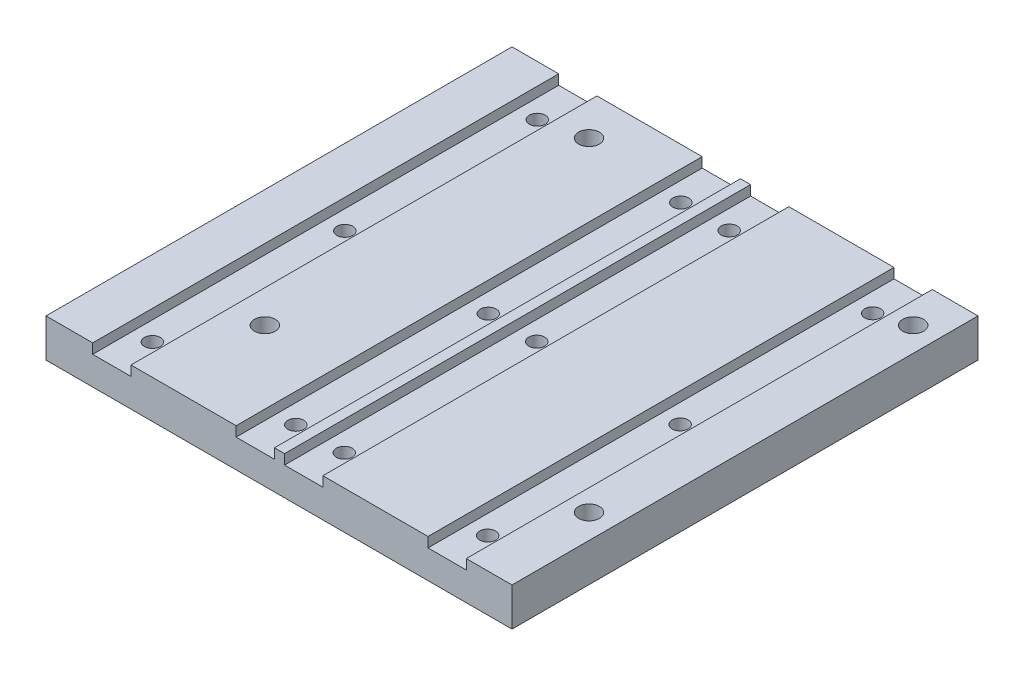
from build123d import *

# Parameters (mm, degrees)
SKETCH1_W                                       = 146.05
SKETCH1_H                                       = 146.05
BOSS_EXTRUDE1_DEPTH                             = 12
F_1_4_CLEARANCE_HOLE1_D                         = 6.5278
SKETCH4_W                                       = 12
SKETCH4_H                                       = 3.11
CUT_EXTRUDE1_DEPTH                              = 164.729206695
CBORE_FOR_10_SOCKET_HEAD_CAP_SCREW1_D           = 4.9784
CBORE_FOR_10_SOCKET_HEAD_CAP_SCREW1_CBORE_D     = 9.525
CBORE_FOR_10_SOCKET_HEAD_CAP_SCREW1_CBORE_DEPTH = 5.08
LPATTERN1_COUNT                                 = 2
LPATTERN1_PITCH                                 = 44.958
LPATTERN1_COUNT_DIR2                            = 2
LPATTERN1_PITCH_DIR2                            = 60.132999876


with BuildPart() as part:
    # Sketch1 → Boss-Extrude1 (new body)
    with BuildSketch(Plane(origin=(0, 0, 0), x_dir=(1, 0, 0), z_dir=(0, 1, 0))):
        Rectangle(SKETCH1_W, SKETCH1_H)
    extrude(amount=-BOSS_EXTRUDE1_DEPTH)

    # 1/4 Clearance Hole1 (through all)
    with Locations(Plane(origin=(0, 0, 0), x_dir=(1, 0, 0), z_dir=(0, 1, 0))):
        with Locations((-36.195, 60.325), (-36.195, -41.275), (65.405, -41.275), (65.405, 60.325)):
            Hole(F_1_4_CLEARANCE_HOLE1_D / 2)

    # Sketch4 → Cut-Extrude1 (cut, through all)
    with BuildSketch(Plane.XY.offset(73.025)):
        with Locations((52.705, -1.555)):
            Rectangle(SKETCH4_W, SKETCH4_H)
    cut_extrude1 = extrude(amount=-CUT_EXTRUDE1_DEPTH, mode=Mode.SUBTRACT)

    # CBORE for #10 Socket Head Cap Screw1 (through all)
    with Locations(Plane(origin=(0, -12, 0), x_dir=(-1, 0, 0), z_dir=(0, -1, 0))):
        with Locations((-52.705, -60.325), (-52.705, 60.325), (-52.705, 0)):
            cbore_for_10_socket_head_cap_screw1 = CounterBoreHole(CBORE_FOR_10_SOCKET_HEAD_CAP_SCREW1_D / 2, CBORE_FOR_10_SOCKET_HEAD_CAP_SCREW1_CBORE_D / 2, CBORE_FOR_10_SOCKET_HEAD_CAP_SCREW1_CBORE_DEPTH)

    # LPattern1: Cut-Extrude1, CBORE for _10 Socket Head Cap Screw1 2 × 2
    with Locations(*[Vector(-1, 0, 0) * (i * LPATTERN1_PITCH) + Vector(-1, 0, 0) * (j * LPATTERN1_PITCH_DIR2) for i in range(LPATTERN1_COUNT) for j in range(LPATTERN1_COUNT_DIR2) if (i, j) != (0, 0)]):
        add(cut_extrude1, mode=Mode.SUBTRACT)
        add(cbore_for_10_socket_head_cap_screw1, mode=Mode.SUBTRACT)


solid = part.part
